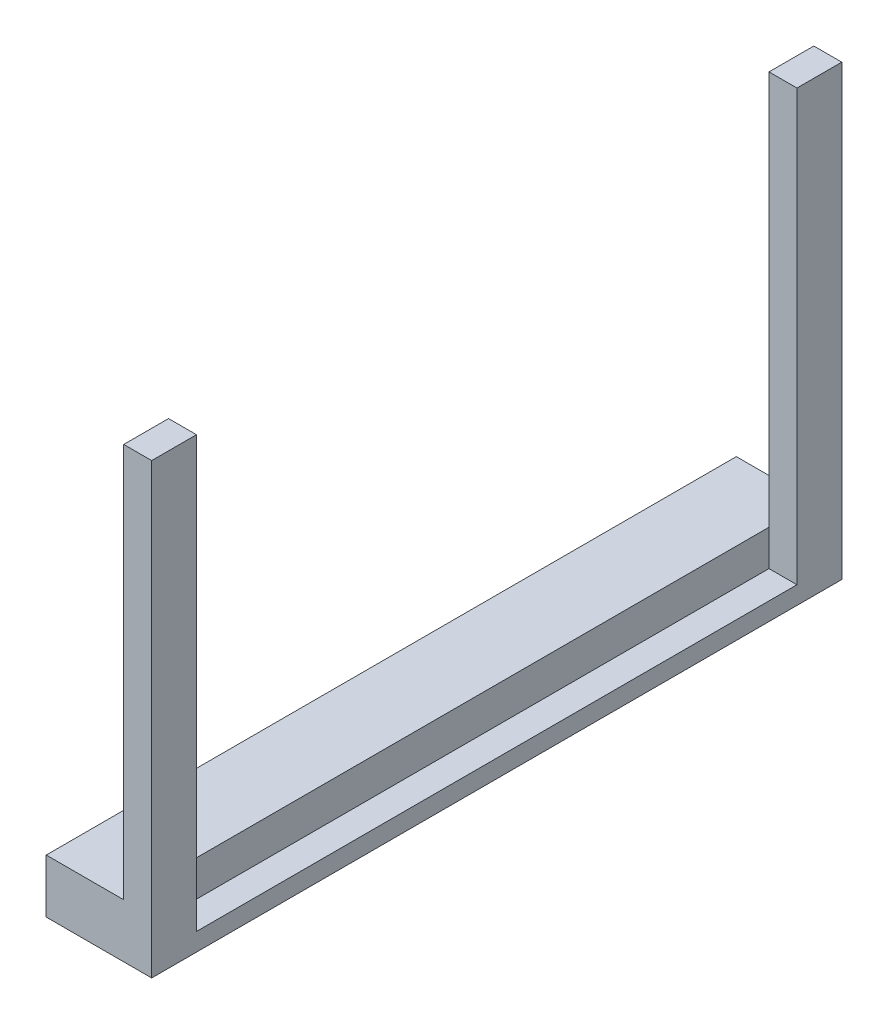
from build123d import *

# Parameters (mm, degrees)
SKETCH1_W           = 3.12
SKETCH1_H           = 48
BOSS_EXTRUDE1_DEPTH = 5
BOSS_EXTRUDE2_DEPTH = 2
SKETCH4_W           = 5.685554951
SKETCH4_H           = 2
BOSS_EXTRUDE3_DEPTH = 33.5
SKETCH5_W           = 77
SKETCH5_H           = 2
BOSS_EXTRUDE4_DEPTH = 6.08
SKETCH6_W           = 8.645554951
SKETCH6_H           = 77
BOSS_EXTRUDE5_DEPTH = 4


with BuildPart() as part:
    # Sketch1 → Boss-Extrude1 (new body)
    with BuildSketch(Plane.XY):
        Rectangle(SKETCH1_W, SKETCH1_H)
    extrude(amount=-BOSS_EXTRUDE1_DEPTH)

    # Sketch3 → Boss-Extrude2 (add)
    with BuildSketch(Plane(origin=(0, -24, 0), x_dir=(-1, 0, 0), z_dir=(0, -1, 0))):
        Polygon((2.345, 0), (4.125554951, 0), (4.125554951, 5), (1.56, 5), (-1.56, 5), (-1.56, 0), align=None)
    extrude(amount=BOSS_EXTRUDE2_DEPTH)

    # Sketch4 → Boss-Extrude3 (add)
    with BuildSketch(Plane(origin=(0, 0, -5), x_dir=(-1, 0, 0), z_dir=(0, 0, -1))):
        with Locations((1.282777476, -25)):
            Rectangle(SKETCH4_W, SKETCH4_H)
    extrude(amount=BOSS_EXTRUDE3_DEPTH)

    # Mirror7: part across plane


with BuildPart() as part_1:
    add(part.part)
    add(part.part.mirror(Plane.XY.offset(-38.5)))

    # Sketch5 → Boss-Extrude4 (add)
    with BuildSketch(Plane.ZY.offset(4.125554951)):
        with Locations((-38.5, -25)):
            Rectangle(SKETCH5_W, SKETCH5_H)
    extrude(amount=BOSS_EXTRUDE4_DEPTH)

    # Sketch6 → Boss-Extrude5 (add)
    with BuildSketch(Plane(origin=(0, -24, 0), x_dir=(1, 0, 0), z_dir=(0, 1, 0))):
        with Locations((-5.882777476, 38.5)):
            Rectangle(SKETCH6_W, SKETCH6_H)
    extrude(amount=BOSS_EXTRUDE5_DEPTH)


solid = part_1.part
